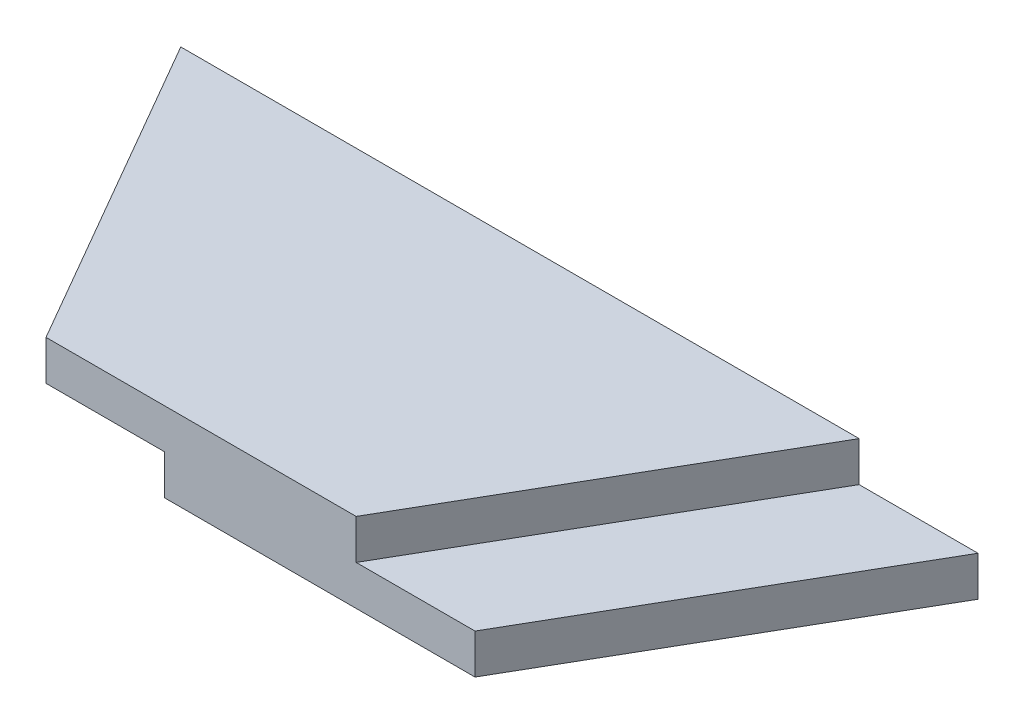
from build123d import *

# Parameters (mm, degrees)
SKETCH_1_W          = 80
SKETCH_1_H          = 20
EXTRUDE_1_DEPTH     = 200
CUT_EXTRUDE_1_DEPTH = 10
CUT_EXTRUDE_2_DEPTH = 10
SKETCH_4_OUTSIDE_W  = 245.266
SKETCH_4_OUTSIDE_H  = 125.266
CUT_EXTRUDE_4_DEPTH = 217.333076528


with BuildPart() as part:
    # Эскиз1 → Бобышка-Вытянуть1 (new body)
    with BuildSketch(Plane(origin=(0, 0, 0), x_dir=(0, 0, -1), z_dir=(1, 0, 0))):
        with Locations((40, 10)):
            Rectangle(SKETCH_1_W, SKETCH_1_H)
    extrude(amount=EXTRUDE_1_DEPTH)

    # Эскиз2 → Вырез-Вытянуть1 (cut)
    with BuildSketch(Plane.XZ):
        Polygon((75.938021535, 0), (29.75, -80), (0, -80), (0, 0), align=None)
    extrude(amount=-CUT_EXTRUDE_1_DEPTH, mode=Mode.SUBTRACT)

    # Эскиз3 → Вырез-Вытянуть2 (cut)
    with BuildSketch(Plane(origin=(0, 20, 0), x_dir=(1, 0, 0), z_dir=(0, 1, 0))):
        Polygon((124, 0), (170.188021535, 80), (200, 80), (200, 0), align=None)
    extrude(amount=-CUT_EXTRUDE_2_DEPTH, mode=Mode.SUBTRACT)

    # Эскиз4 outside → Вырез-Вытянуть4 (cut, through all)
    with BuildSketch(Plane(origin=(0, 20, 0), x_dir=(1, 0, 0), z_dir=(0, 1, 0))):
        with Locations((100, 40)):
            Rectangle(SKETCH_4_OUTSIDE_W, SKETCH_4_OUTSIDE_H)
        Polygon((200, 80), (153.811978465, 0), (46.188021535, 0), (0, 80), align=None, mode=Mode.SUBTRACT)
    extrude(amount=-CUT_EXTRUDE_4_DEPTH, mode=Mode.SUBTRACT)


solid = part.part
